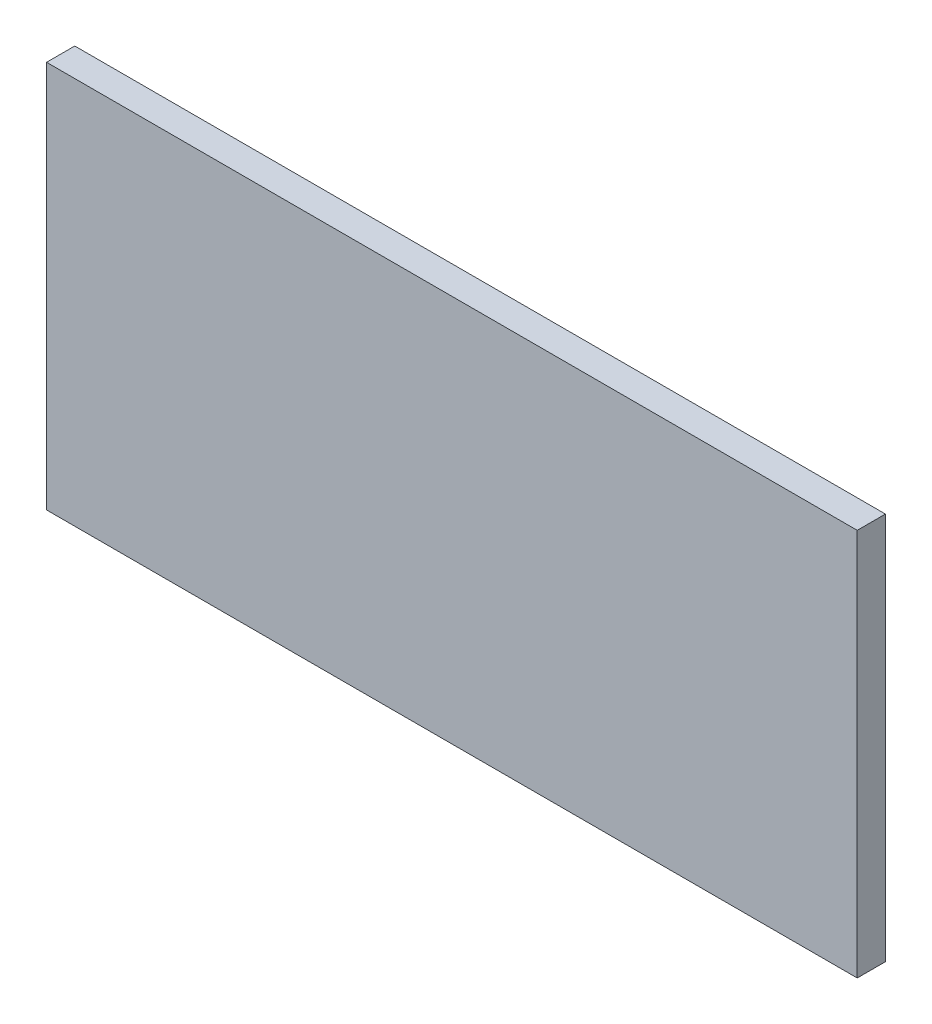
from build123d import *

# Parameters (mm, degrees)
SKETCH_1_W      = 230
SKETCH_1_H      = 110
EXTRUDE_2_DEPTH = 8


with BuildPart() as part:
    # 草图1 → 凸台-拉伸2 (new body)
    with BuildSketch(Plane.XY):
        Rectangle(SKETCH_1_W, SKETCH_1_H)
    extrude(amount=EXTRUDE_2_DEPTH)


solid = part.part
